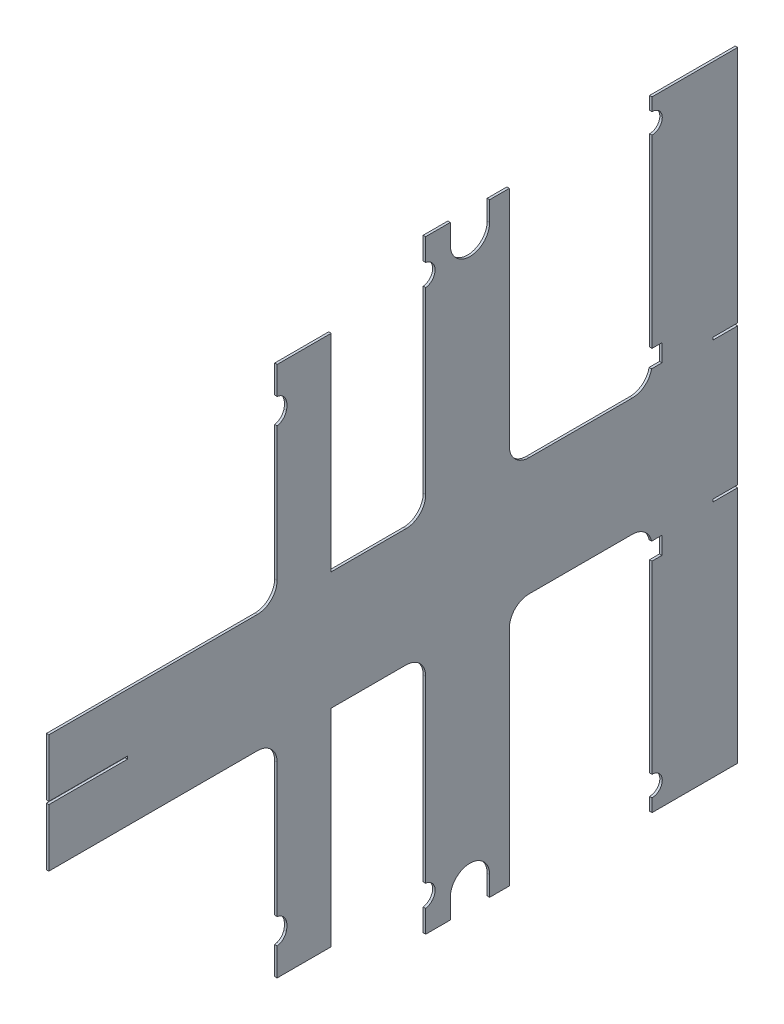
from build123d import *

# Parameters (mm, degrees)
BOSS_EXTRUDE1_DEPTH = 1.5875
SKETCH2_R           = 13.081
CUT_EXTRUDE1_DEPTH  = 282.7782
CUT_EXTRUDE2_REACH  = 907.396
SKETCH3_R           = 13.081
SKETCH5_RX          = 13.458967046
SKETCH5_RY          = 13.27706685
CUT_EXTRUDE3_DEPTH  = 850.411898389
SKETCH7_RX          = 13.827169688
SKETCH7_RY          = 13.509347203
CUT_EXTRUDE4_DEPTH  = 850.411898525
SURFACECUT1_ANGLE   = 12.730551
CUT_EXTRUDE13_DEPTH = 850.411898527
CUT_EXTRUDE14_START = -3.175
CUT_EXTRUDE14_DEPTH = 3.175
CUT_EXTRUDE15_DEPTH = 850.411898527
CUT_EXTRUDE16_DEPTH = 850.411898527
FILLET1_R           = 25.4
SKETCH28_W          = 101.6
SKETCH28_H          = 1.7907
CUT_EXTRUDE17_DEPTH = 850.411898527
CUT_EXTRUDE18_DEPTH = 850.411898527
CUT_EXTRUDE19_DEPTH = 850.411898527


# Read off the part's stored shape, not the designer's step: SurfaceCut1, Cut-Extrude14
with BuildPart() as part:
    # Sketch1 → Boss-Extrude1 (new, symmetric)
    with BuildSketch(Plane(origin=(-71.4375, 0, 0), x_dir=(0, 0, -1), z_dir=(1, 0, 0))):
        Polygon((139.7, -400.05), (29.21, -400.05), (29.21, -76.2), (-154.94, -76.2), (-154.94, -389.89), (-262.89, -389.89), (-262.89, -76.2), (-384.81, -76.2), (-384.81, -342.9), (-454.66, -342.9), (-454.66, -76.2), (-749.3, -76.2), (-749.3, 76.2), (-454.66, 76.2), (-454.66, 342.9), (-384.81, 342.9), (-384.81, 76.2), (-262.89, 76.2), (-262.89, 389.89), (-154.94, 389.89), (-154.94, 76.2), (29.21, 76.2), (29.21, 400.05), (139.7, 400.05), (139.7, 92.075), (107.95, 92.075), (107.95, 88.9), (139.7, 88.9), (139.7, -88.9), (107.95, -88.9), (107.95, -92.075), (139.7, -92.075), align=None)
    extrude(amount=BOSS_EXTRUDE1_DEPTH, both=True)

    # Sketch2 → Cut-Extrude1 (cut)
    with BuildSketch(Plane(origin=(209.7532, 370.332, -29.3624), x_dir=(0, 0, -1), z_dir=(1, 0, 0))):
        Circle(SKETCH2_R)
    cut_extrude1 = extrude(amount=-CUT_EXTRUDE1_DEPTH, mode=Mode.SUBTRACT)

    # Cut-Extrude2: up to this plane
    cut_extrude2_end = Plane(origin=(-73.025, 0, 0), z_dir=(-1, 0, 0))
    # Sketch3 → Cut-Extrude2 (cut, up to the surface)
    with BuildSketch(Plane(origin=(4.654591859, 367.519252147, 275.4376), x_dir=(0.13291538281760473, 0.03562595760229639, -0.9904868965086662), z_dir=(0.9567163781525703, 0.25643335182849597, 0.13760707774177544)), mode=Mode.PRIVATE) as cut_extrude2_sk1:
        Circle(SKETCH3_R)
    cut_extrude2_tool1 = split(extrude(cut_extrude2_sk1.sketch, amount=-CUT_EXTRUDE2_REACH, mode=Mode.PRIVATE), bisect_by=cut_extrude2_end, keep=Keep.BOTH, mode=Mode.PRIVATE)
    cut_extrude2 = cut_extrude2_tool1.solids().sort_by_distance((4.654592, 367.519252, 275.4376))[0]
    add(cut_extrude2, mode=Mode.SUBTRACT)

    # Sketch5 → Cut-Extrude3 (cut, through all)
    with BuildSketch(Plane(origin=(-69.85, 0, 0), x_dir=(0, 0, -1), z_dir=(1, 0, 0))):
        with Locations(Location((-264.721405109, 347.549423415), (0, 0, 82.179315893))):
            Ellipse(SKETCH5_RX, SKETCH5_RY)
    cut_extrude3 = extrude(amount=-CUT_EXTRUDE3_DEPTH, mode=Mode.SUBTRACT)

    # Sketch7 → Cut-Extrude4 (cut, through all)
    with BuildSketch(Plane.ZY.offset(73.025)):
        with Locations(Location((264.264736359, 346.698412696), (0, 0, -95.705935517))):
            Ellipse(SKETCH7_RX, SKETCH7_RY)
    cut_extrude4 = extrude(amount=-CUT_EXTRUDE4_DEPTH, mode=Mode.SUBTRACT)

    # SurfaceCut1 outline → SurfaceCut1 (revolve, cut)
    with BuildSketch(Plane(origin=(-25.4, 215.408274925, 0), x_dir=(-0.43753517000423214, 0.899201298380606, 0), z_dir=(0.899201298380606, 0.43753517000423214, 0))):
        with BuildLine():
            ThreePointArc((76.208166822, 454.660000025), (88.899999997, 442.415379638), (101.591833177, 454.660000021))
            Line((101.591833177, 454.660000021), (76.208166822, 454.660000025))
        make_face()
    surfacecut1 = revolve(axis=Axis((-25.4, 215.408274925, 0), (0, 0, 1)), revolution_arc=SURFACECUT1_ANGLE, mode=Mode.SUBTRACT)

    # Sketch21 → Cut-Extrude13 (cut, through all)
    with BuildSketch(Plane.ZY.offset(73.025)):
        with BuildLine():
            Line((454.66, 303.637577447), (454.66, 274.279071706))
            ThreePointArc((454.66, 274.279071706), (442.249689548, 288.958324577), (454.66, 303.637577447))
        make_face()
    cut_extrude13 = extrude(amount=-CUT_EXTRUDE13_DEPTH, mode=Mode.SUBTRACT)

    # Cut-Extrude14 outline → Cut-Extrude14 (cut)
    with BuildSketch(Plane(origin=(-69.85, 0, 0), x_dir=(0, 0, -1), z_dir=(1, 0, 0)).offset(CUT_EXTRUDE14_START)):
        with BuildLine():
            Line((-454.66, 291.370782877), (-442.446465515, 291.370782877))
            add(Edge.make_bspline(
                [(-442.446465515, 291.370782877), (-442.305604528, 293.829318521), (-442.944960374, 298.079765742), (-445.927339463, 302.763682225), (-449.764908378, 305.786294337), (-452.799544613, 306.691151874), (-454.66, 306.759783223)],
                knots=[0, 0, 0, 0, 0.33604966, 0.578754716, 0.743869723, 1, 1, 1, 1], degree=3))
            Line((-454.66, 306.759783223), (-454.66, 291.370782877))
        make_face()
    cut_extrude14 = extrude(amount=CUT_EXTRUDE14_DEPTH, mode=Mode.SUBTRACT)

    # Sketch25 → Cut-Extrude15 (cut, through all)
    with BuildSketch(Plane(origin=(-69.85, 0, 0), x_dir=(0, 0, -1), z_dir=(1, 0, 0))):
        with BuildLine():
            Line((-442.434347234, 291.295796674), (-456.435114382, 293.070911057))
            Line((-456.435114382, 293.070911057), (-454.66, 307.071678205))
            ThreePointArc((-454.66, 307.071678205), (-445.279881573, 301.715753032), (-442.434347234, 291.295796674))
        make_face()
    cut_extrude15 = extrude(amount=-CUT_EXTRUDE15_DEPTH, mode=Mode.SUBTRACT)

    # Sketch27 → Cut-Extrude16 (cut, through all)
    with BuildSketch(Plane(origin=(-69.85, 0, 0), x_dir=(0, 0, -1), z_dir=(1, 0, 0))):
        with BuildLine():
            Line((-443.216925762, 283.679849678), (-443.400538268, 298.481302661))
            ThreePointArc((-443.400538268, 298.481302661), (-441.972420297, 291.09715316), (-443.216925762, 283.679849678))
        make_face()
    cut_extrude16 = extrude(amount=-CUT_EXTRUDE16_DEPTH, mode=Mode.SUBTRACT)

    # Mirror1: Cut-Extrude1, Cut-Extrude2, Cut-Extrude3, Cut-Extrude4, SurfaceCut1, Cut-Extrude13, Cut-Extrude14, Cut-Extrude15, Cut-Extrude16 across plane
    add(cut_extrude1.mirror(Plane.ZX), mode=Mode.SUBTRACT)
    add(cut_extrude2.mirror(Plane.ZX), mode=Mode.SUBTRACT)
    add(cut_extrude3.mirror(Plane.ZX), mode=Mode.SUBTRACT)
    add(cut_extrude4.mirror(Plane.ZX), mode=Mode.SUBTRACT)
    add(surfacecut1.mirror(Plane.ZX), mode=Mode.SUBTRACT)
    add(cut_extrude13.mirror(Plane.ZX), mode=Mode.SUBTRACT)
    add(cut_extrude14.mirror(Plane.ZX), mode=Mode.SUBTRACT)
    add(cut_extrude15.mirror(Plane.ZX), mode=Mode.SUBTRACT)
    add(cut_extrude16.mirror(Plane.ZX), mode=Mode.SUBTRACT)

    # Fillet1
    fillet1_edges = [part.edges().sort_by_distance(p)[0] for p in [
        (-71.4375, -76.2, -29.21),
        (-71.4375, -76.2, 154.94),
        (-71.4375, -76.2, 262.89),
        (-71.4375, -76.2, 454.66),
        (-71.4375, 76.2, 454.66),
        (-71.4375, 76.2, 262.89),
        (-71.4375, 76.2, 154.94),
        (-71.4375, 76.2, -29.21),
    ]]
    fillet(fillet1_edges, radius=FILLET1_R)

    # Sketch28 → Cut-Extrude17 (cut, through all)
    with BuildSketch(Plane(origin=(-69.85, 0, 0), x_dir=(0, 0, -1), z_dir=(1, 0, 0))):
        with Locations((-698.5, -0.89535)):
            Rectangle(SKETCH28_W, SKETCH28_H)
        with Locations((-698.5, 0.89535)):
            Rectangle(SKETCH28_W, SKETCH28_H)
    extrude(amount=-CUT_EXTRUDE17_DEPTH, mode=Mode.SUBTRACT)

    # Sketch29 → Cut-Extrude18 (cut, through all)
    with BuildSketch(Plane(origin=(-69.85, 0, 0), x_dir=(0, 0, -1), z_dir=(1, 0, 0))):
        Polygon((29.21, 118.85525736), (41.91, 118.85525736), (41.91, 96.357238024), (28.663036975, 96.357238024), align=None)
        Polygon((29.21, -118.85525736), (41.91, -118.85525736), (41.91, -96.357238024), (28.663036975, -96.357238024), align=None)
    extrude(amount=-CUT_EXTRUDE18_DEPTH, mode=Mode.SUBTRACT)

    # Sketch30 → Cut-Extrude19 (cut, through all)
    with BuildSketch(Plane(origin=(-69.85, 0, 0), x_dir=(0, 0, -1), z_dir=(1, 0, 0))):
        with BuildLine():
            Line((-231.14, 389.89), (-231.14, 364.49))
            ThreePointArc((-231.14, 364.49), (-205.74, 339.09), (-180.34, 364.49))
            Line((-180.34, 364.49), (-180.34, 389.89))
            Line((-180.34, 389.89), (-231.14, 389.89))
        make_face()
    cut_extrude19 = extrude(amount=-CUT_EXTRUDE19_DEPTH, mode=Mode.SUBTRACT)

    # Mirror2: Cut-Extrude19 across plane
    add(cut_extrude19.mirror(Plane.ZX), mode=Mode.SUBTRACT)


solid = part.part
